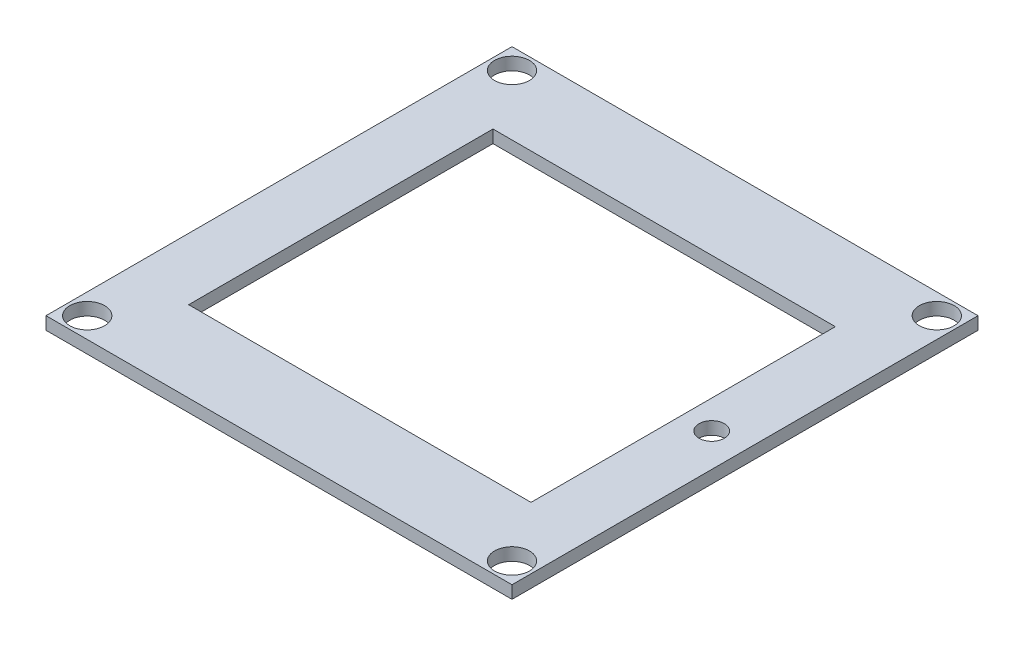
from build123d import *

# Parameters (mm, degrees)
SKETCH1_W               = 294
SKETCH1_H               = 294
SKETCH1_W_2             = 216
SKETCH1_H_2             = 192
BOSS_EXTRUDE1_DEPTH     = 8
SKETCH2_R               = 11
CUT_EXTRUDE1_DEPTH      = 209.043264731
SKETCH4_R               = 8
CUT_EXTRUDE2_DEPTH      = 209.043264731
MIRROR3_COPY_1_SKETCH_R = 11
MIRROR3_COPY_1_DEPTH    = 209.043264731


with BuildPart() as part:
    # Sketch1 → Boss-Extrude1 (new body)
    with BuildSketch(Plane(origin=(0, 0, 0), x_dir=(1, 0, 0), z_dir=(0, 1, 0))):
        Rectangle(SKETCH1_W, SKETCH1_H)
        Rectangle(SKETCH1_W_2, SKETCH1_H_2, mode=Mode.SUBTRACT)
    extrude(amount=BOSS_EXTRUDE1_DEPTH)

    # Sketch2 → Cut-Extrude1 (cut, through all)
    with BuildSketch(Plane(origin=(0, 0, 0), x_dir=(1, 0, 0), z_dir=(0, 1, 0))):
        with Locations((134, 134)):
            Circle(SKETCH2_R)
    cut_extrude1 = extrude(amount=CUT_EXTRUDE1_DEPTH, mode=Mode.SUBTRACT)

    # Mirror2: Cut-Extrude1 across plane
    add(cut_extrude1.mirror(Plane.XY), mode=Mode.SUBTRACT)

    # Sketch4 → Cut-Extrude2 (cut, through all)
    with BuildSketch(Plane(origin=(0, 8, 0), x_dir=(1, 0, 0), z_dir=(0, 1, 0))):
        with Locations((126, 0)):
            Circle(SKETCH4_R)
    extrude(amount=-CUT_EXTRUDE2_DEPTH, mode=Mode.SUBTRACT)

    # Mirror3: Cut-Extrude1 across plane
    add(cut_extrude1.mirror(Plane(origin=(0, 0, 0), x_dir=(0, 0, 1), z_dir=(1, 0, 0))), mode=Mode.SUBTRACT)

    # Mirror3 copy 1 sketch → Mirror3 copy 1 (cut, through all)
    with BuildSketch(Plane(origin=(0, 0, 0), x_dir=(-1, 0, 0), z_dir=(0, 1, 0))):
        with Locations((134, 134)):
            Circle(MIRROR3_COPY_1_SKETCH_R)
    extrude(amount=MIRROR3_COPY_1_DEPTH, mode=Mode.SUBTRACT)


solid = part.part
